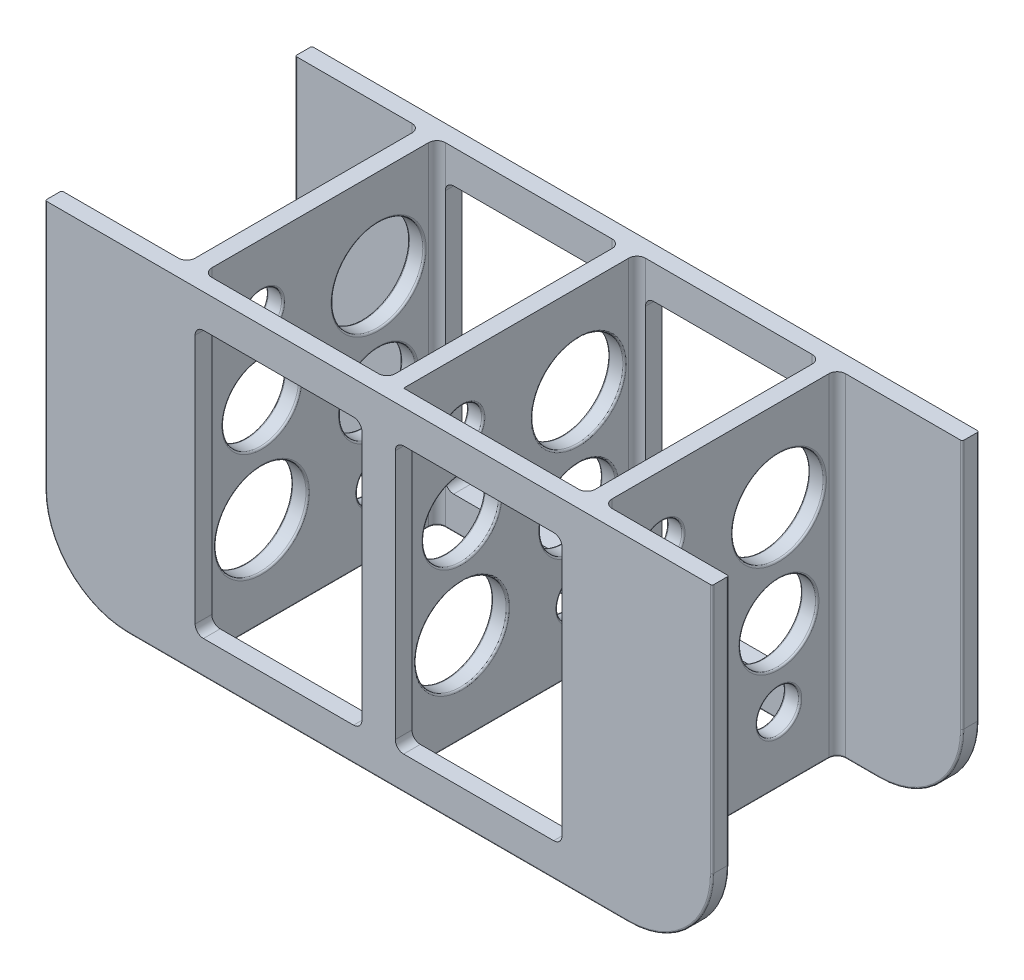
from build123d import *

# Parameters (mm, degrees)
SKIZZE1_W                            = 22
SKIZZE1_H                            = 28
AUFSATZ_LINEAR_AUSTRAGEN1_DEPTH      = 40
SKIZZE2_R                            = 5.5
SKIZZE2_R_2                          = 4.6
SKIZZE2_R_3                          = 2.55
SCHNITT_LINEAR_AUSTRAGEN1_DEPTH      = 78.98076686
SCHNITT_LINEAR_AUSTRAGEN2_DEPTH      = 65.031242374
SCHNITT_LINEAR_AUSTRAGEN2_DEPTH_BACK = 65.031242374
SKIZZE3_W                            = 20
SKIZZE3_H                            = 32
VERRUNDUNG1_R                        = 10
VERRUNDUNG2_R                        = 1
VERRUNDUNG3_R                        = 1
VERRUNDUNG4_R                        = 0.2
VERRUNDUNG5_R                        = 0.2


with BuildPart() as part:
    # Skizze1 → Aufsatz-Linear austragen1 (new body)
    with BuildSketch(Plane(origin=(0, 0, 0), x_dir=(1, 0, 0), z_dir=(0, 1, 0))):
        Polygon((-25, -14), (-25, 14), (-40, 14), (-40, 16), (40, 16), (40, 14), (25, 14), (25, -14), (40, -14), (40, -16), (-40, -16), (-40, -14), align=None)
        with Locations((-12, 0)):
            Rectangle(SKIZZE1_W, SKIZZE1_H, mode=Mode.SUBTRACT)
        with Locations((12, 0)):
            Rectangle(SKIZZE1_W, SKIZZE1_H, mode=Mode.SUBTRACT)
    extrude(amount=AUFSATZ_LINEAR_AUSTRAGEN1_DEPTH)

    # Skizze2 → Schnitt-Linear austragen1 (cut, through all)
    with BuildSketch(Plane.ZY.offset(25)):
        with Locations((-7, 29.15)):
            Circle(SKIZZE2_R)
        with Locations((-7, 17.05)):
            Circle(SKIZZE2_R_2)
        with Locations((-7, 7.9)):
            Circle(SKIZZE2_R_3)
        with Locations((7, 32.1)):
            Circle(SKIZZE2_R_3)
        with Locations((7, 22.95)):
            Circle(SKIZZE2_R_2)
        with Locations((7, 10.85)):
            Circle(SKIZZE2_R)
    extrude(amount=-SCHNITT_LINEAR_AUSTRAGEN1_DEPTH, mode=Mode.SUBTRACT)

    # Skizze3 → Schnitt-Linear austragen2 (cut, two sides: drawn at the far end of the back side and taken through both)
    with BuildSketch(Plane.XY.offset(-14).offset(-SCHNITT_LINEAR_AUSTRAGEN2_DEPTH_BACK)):
        with Locations((-12, 20)):
            Rectangle(SKIZZE3_W, SKIZZE3_H)
        with Locations((12, 20)):
            Rectangle(SKIZZE3_W, SKIZZE3_H)
    extrude(amount=SCHNITT_LINEAR_AUSTRAGEN2_DEPTH + SCHNITT_LINEAR_AUSTRAGEN2_DEPTH_BACK, mode=Mode.SUBTRACT)

    # Verrundung1
    verrundung1_edges = [part.edges().sort_by_distance(p)[0] for p in [
        (40, 0, -15),
        (40, 0, 15),
        (-40, 0, 15),
        (-40, 0, -15),
    ]]
    fillet(verrundung1_edges, radius=VERRUNDUNG1_R)

    # Verrundung2
    verrundung2_edges = [part.edges().sort_by_distance(p)[0] for p in [
        (25, 20, -14),
        (25, 20, 14),
        (-25, 20, 14),
        (-25, 20, -14),
        (-1, 20, -14),
        (-23, 20, -14),
        (-23, 20, 14),
        (-1, 20, 14),
        (23, 20, 14),
        (23, 20, -14),
        (1, 20, -14),
    ]]
    fillet(verrundung2_edges, radius=VERRUNDUNG2_R - 0.0001)  # a hair under: the kernel refuses the full size

    # Verrundung3
    verrundung3_edges = [part.edges().sort_by_distance(p)[0] for p in [
        (-2, 36, -15),
        (-2, 4, -15),
        (-22, 4, -15),
        (-22, 36, -15),
        (-2, 36, 15),
        (-2, 4, 15),
        (-22, 4, 15),
        (-22, 36, 15),
        (22, 36, -15),
        (22, 4, -15),
        (2, 4, -15),
        (2, 36, -15),
        (22, 36, 15),
        (22, 4, 15),
        (2, 4, 15),
        (2, 36, 15),
    ]]
    fillet(verrundung3_edges, radius=VERRUNDUNG3_R)

    # Verrundung4
    verrundung4_edges = [part.edges().sort_by_distance(p)[0] for p in [
        (0, 0, -16),
        (-37.071067812, 2.928932188, -16),
        (37.071067812, 2.928932188, -16),
        (27.99995, 0, 14),
        (0, 0, 16),
        (-27.99995, 0, -14),
        (37.071067812, 2.928932188, -14),
        (37.071067812, 2.928932188, 14),
        (-37.071067812, 2.928932188, 16),
        (37.071067812, 2.928932188, 16),
        (-37.071067812, 2.928932188, 14),
        (-37.071067812, 2.928932188, -14),
        (40, 25, -16),
        (40, 25, -14),
        (40, 25, 14),
        (40, 25, 16),
        (-40, 25, 16),
        (25, 0, 0),
        (-40, 25, 14),
        (27.99995, 0, -14),
        (-40, 25, -14),
        (12, 0, -14),
        (-40, 25, -16),
        (1, 0, 0.49995),
        (-12, 0, -14),
        (-23, 0, 0),
        (-12, 0, 14),
        (-25, 0, 0),
        (-27.99995, 0, 14),
        (-1, 0, 0),
        (23, 0, 0),
        (25.292863929, 0, 13.707136071),
        (25.292863929, 0, -13.707136071),
        (1.292863929, 0, -13.707136071),
        (-22.707136071, 0, -13.707136071),
        (-22.707136071, 0, 13.707136071),
        (-25.292863929, 0, -13.707136071),
        (-25.292863929, 0, 13.707136071),
        (-1.292863929, 0, 13.707136071),
        (-1.292863929, 0, -13.707136071),
        (22.707136071, 0, -13.707136071),
        (22.707136071, 0, 13.707136071),
        (11.50005, 0, 14),
    ]]
    fillet(verrundung4_edges, radius=VERRUNDUNG4_R)

    # Verrundung5
    verrundung5_edges = [part.edges().sort_by_distance(p)[0] for p in [
        (25, 10.85, 1.5),
        (-1, 10.85, 1.5),
        (-23, 10.85, 1.5),
        (1, 10.85, 1.5),
        (23, 10.85, 1.5),
        (-25, 10.85, 1.5),
        (25, 29.15, -12.5),
        (-1, 29.15, -12.5),
        (-23, 29.15, -12.5),
        (1, 29.15, -12.5),
        (23, 29.15, -12.5),
        (-25, 29.15, -12.5),
        (25, 17.05, -11.6),
        (-1, 17.05, -11.6),
        (-23, 17.05, -11.6),
        (1, 17.05, -11.6),
        (23, 17.05, -11.6),
        (-25, 17.05, -11.6),
        (25, 7.9, -9.55),
        (-1, 7.9, -9.55),
        (-23, 7.9, -9.55),
        (1, 7.9, -9.55),
        (23, 7.9, -9.55),
        (-25, 7.9, -9.55),
        (25, 32.1, 4.45),
        (-1, 32.1, 4.45),
        (-23, 32.1, 4.45),
        (1, 32.1, 4.45),
        (23, 32.1, 4.45),
        (-25, 32.1, 4.45),
        (25, 22.95, 2.4),
        (-1, 22.95, 2.4),
        (-23, 22.95, 2.4),
        (1, 22.95, 2.4),
        (23, 22.95, 2.4),
        (-25, 22.95, 2.4),
    ]]
    fillet(verrundung5_edges, radius=VERRUNDUNG5_R)


solid = part.part
